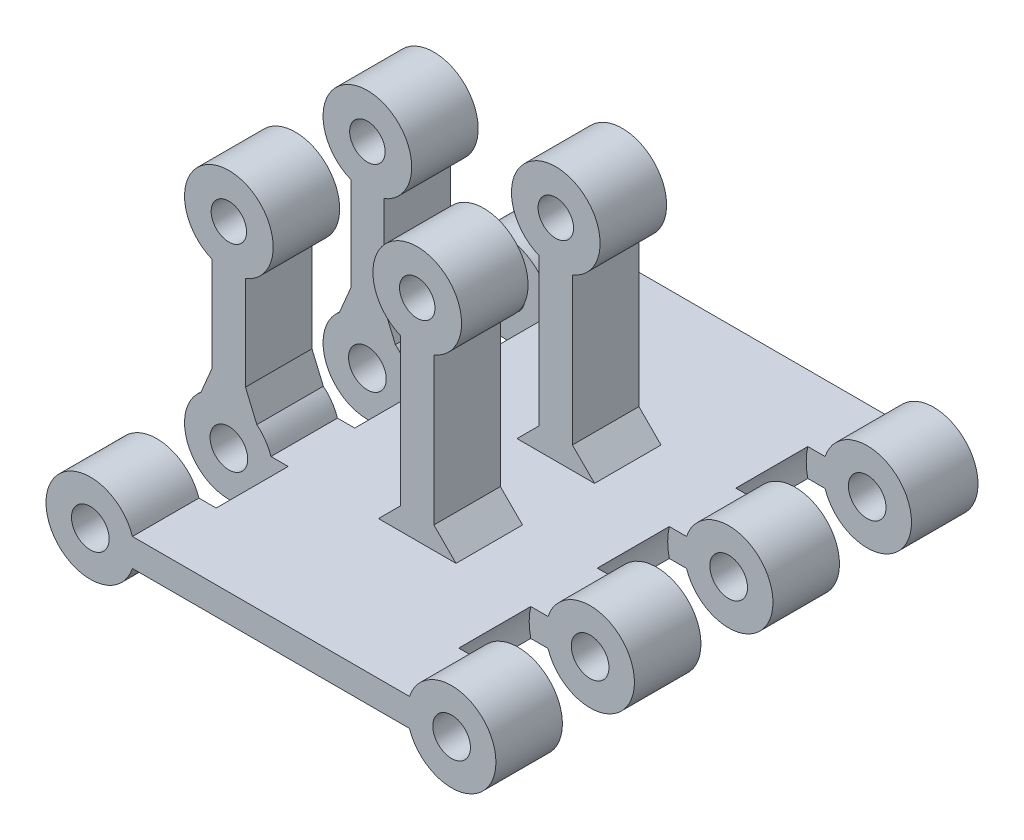
from build123d import *

# Parameters (mm, degrees)
SKETCH_2_R                   = 4
SKETCH_2_R_2                 = 1.7
EXTRUDE_1_DEPTH              = 6
PATTERN_LINEAR_1_COUNT       = 4
PATTERN_LINEAR_1_PITCH       = 12.5
EXTRUDE_START                = -43.5
SKETCH_3_W                   = 25
SKETCH_3_H                   = 2.5
EXTRUDE_2_DEPTH              = 43.5
SKETCH_4_R                   = 5.5
CUT_EXTRUDE_1_DEPTH          = 6.5
PATTERN_LINEAR_2_COUNT       = 4
PATTERN_LINEAR_2_PITCH       = 12.5
PATTERN_START                = 12.5
PATTERN_LINEAR_3_OUTLINE_R   = 1.7
PATTERN_LINEAR_3_DEPTH       = 6
PATTERN_START_2              = 25
PATTERN_LINEAR_3_2_OUTLINE_R = 1.7
PATTERN_LINEAR_3_2_DEPTH     = 6
PATTERN_START_3              = 37.5
PATTERN_LINEAR_3_3_OUTLINE_R = 1.7
PATTERN_LINEAR_3_3_DEPTH     = 6
MIRROR_3_COPY_1_SKETCH_R     = 5.5
MIRROR_3_COPY_1_DEPTH        = 6.5
MIRROR_3_COPY_2_SKETCH_R     = 5.5
MIRROR_3_COPY_2_DEPTH        = 6.5
MIRROR_3_COPY_3_SKETCH_R     = 5.5
MIRROR_3_COPY_3_DEPTH        = 6.5
SKETCH_5_W                   = 3
SKETCH_5_H                   = 14
SKETCH_5_H_2                 = 19
EXTRUDE_3_DEPTH              = 6
SKETCH_6_R                   = 4
EXTRUDE_4_DEPTH              = 6
CUT_EXTRUDE_2_DEPTH          = 20
CUT_EXTRUDE_2_DEPTH_BACK     = 10
SKETCH_7_R                   = 1.6
CHAMFER_1_SIZE               = 2
CHAMFER_2_SIZE               = 1.81151278


with BuildPart() as part:
    # Эскиз2 → Бобышка-Вытянуть1 (new body)
    with BuildSketch(Plane.XY):
        Circle(SKETCH_2_R)
        Circle(SKETCH_2_R_2, mode=Mode.SUBTRACT)
    extrude_1 = extrude(amount=EXTRUDE_1_DEPTH)


with BuildPart() as pattern_linear_1_1:
    # Линейный массив1: pattern copy
    add(part.part.moved(Location(Vector(0, 0, 1) * (1 * PATTERN_LINEAR_1_PITCH))))


with BuildPart() as pattern_linear_1_2:
    # Линейный массив1: pattern copy
    add(part.part.moved(Location(Vector(0, 0, 1) * (2 * PATTERN_LINEAR_1_PITCH))))


with BuildPart() as pattern_linear_1_3:
    # Линейный массив1: pattern copy
    add(part.part.moved(Location(Vector(0, 0, 1) * (3 * PATTERN_LINEAR_1_PITCH))))


with BuildPart() as part_1:
    add(part.part)

    add(pattern_linear_1_1.part)  # Бобышка-Вытянуть2 merges Линейный массив1_1

    add(pattern_linear_1_2.part)  # Бобышка-Вытянуть2 merges Линейный массив1_2

    add(pattern_linear_1_3.part)  # Бобышка-Вытянуть2 merges Линейный массив1_3
    # Эскиз3 → Бобышка-Вытянуть2 (add)
    with BuildSketch(Plane(origin=(0, 0, 0), x_dir=(-1, 0, 0), z_dir=(0, 0, -1)).offset(EXTRUDE_START)):
        with Locations((16.299671038, 0)):
            Rectangle(SKETCH_3_W, SKETCH_3_H)
    extrude(amount=EXTRUDE_2_DEPTH)

    # Эскиз4 → Вырез-Вытянуть1 (cut)
    with BuildSketch(Plane.XY.offset(6)):
        Circle(SKETCH_4_R)
    cut_extrude_1 = extrude(amount=CUT_EXTRUDE_1_DEPTH, mode=Mode.SUBTRACT)

    # Линейный массив2: Вырез-Вытянуть1 ×4
    with Locations(*[(0, 0, i * PATTERN_LINEAR_2_PITCH) for i in range(1, PATTERN_LINEAR_2_COUNT)]):
        add(cut_extrude_1, mode=Mode.SUBTRACT)

    # Зеркальное отражение1: Бобышка-Вытянуть1 across plane
    add(extrude_1.mirror(Plane.ZY.offset(16.299671038)))

    # Линейный массив3: read off the stored shape, not the designer's step
    # Линейный массив3 outline → Линейный массив3 (add)
    with BuildSketch(Plane.XY.offset(PATTERN_START)):
        with BuildLine():
            ThreePointArc((-28.799671038, 1.25), (-36.599342077, 0), (-28.799671038, -1.25))
            Line((-28.799671038, -1.25), (-28.799671038, 1.25))
        make_face()
        with Locations((-32.599342077, 0)):
            Circle(PATTERN_LINEAR_3_OUTLINE_R, mode=Mode.SUBTRACT)
    extrude(amount=PATTERN_LINEAR_3_DEPTH)

    # Pattern Linear 3 2 outline → Pattern Linear 3 2 (add)
    with BuildSketch(Plane.XY.offset(PATTERN_START_2)):
        with BuildLine():
            ThreePointArc((-28.799671038, 1.25), (-36.599342077, 0), (-28.799671038, -1.25))
            Line((-28.799671038, -1.25), (-28.799671038, 1.25))
        make_face()
        with Locations((-32.599342077, 0)):
            Circle(PATTERN_LINEAR_3_2_OUTLINE_R, mode=Mode.SUBTRACT)
    extrude(amount=PATTERN_LINEAR_3_2_DEPTH)

    # Pattern Linear 3 3 outline → Pattern Linear 3 3 (add)
    with BuildSketch(Plane.XY.offset(PATTERN_START_3)):
        with BuildLine():
            ThreePointArc((-28.799671038, 1.25), (-36.599342077, 0), (-28.799671038, -1.25))
            Line((-28.799671038, -1.25), (-28.799671038, 1.25))
        make_face()
        with Locations((-32.599342077, 0)):
            Circle(PATTERN_LINEAR_3_3_OUTLINE_R, mode=Mode.SUBTRACT)
    extrude(amount=PATTERN_LINEAR_3_3_DEPTH)

    # Зеркальное отражение3: Вырез-Вытянуть1 across plane
    add(cut_extrude_1.mirror(Plane.ZY.offset(16.299671038)), mode=Mode.SUBTRACT)

    # Зеркальное отражение3 copy 1 sketch → Зеркальное отражение3 copy 1 (cut)
    with BuildSketch(Plane(origin=(-32.599342077, 0, 18.5), x_dir=(-1, 0, 0), z_dir=(0, 0, 1))):
        Circle(MIRROR_3_COPY_1_SKETCH_R)
    extrude(amount=MIRROR_3_COPY_1_DEPTH, mode=Mode.SUBTRACT)

    # Зеркальное отражение3 copy 2 sketch → Зеркальное отражение3 copy 2 (cut)
    with BuildSketch(Plane(origin=(-32.599342077, 0, 31), x_dir=(-1, 0, 0), z_dir=(0, 0, 1))):
        Circle(MIRROR_3_COPY_2_SKETCH_R)
    extrude(amount=MIRROR_3_COPY_2_DEPTH, mode=Mode.SUBTRACT)

    # Зеркальное отражение3 copy 3 sketch → Зеркальное отражение3 copy 3 (cut)
    with BuildSketch(Plane(origin=(-32.599342077, 0, 43.5), x_dir=(-1, 0, 0), z_dir=(0, 0, 1))):
        Circle(MIRROR_3_COPY_3_SKETCH_R)
    extrude(amount=MIRROR_3_COPY_3_DEPTH, mode=Mode.SUBTRACT)

    # Эскиз5 → Бобышка-Вытянуть3 (add)
    with BuildSketch(Plane(origin=(0, 0, 12.5), x_dir=(-1, 0, 0), z_dir=(0, 0, -1))):
        with Locations((32.599342077, 10.708099244)):
            Rectangle(SKETCH_5_W, SKETCH_5_H)
        with Locations((15.599342077, 10.75)):
            Rectangle(SKETCH_5_W, SKETCH_5_H_2)
    extrude_3 = extrude(amount=-EXTRUDE_3_DEPTH)

    # Зеркальное отражение4: Бобышка-Вытянуть3 across plane
    add(extrude_3.mirror(Plane.XY.offset(21.75)))

    # Эскиз6 → Бобышка-Вытянуть4 (add)
    with BuildSketch(Plane(origin=(0, 0, 25), x_dir=(-1, 0, 0), z_dir=(0, 0, -1))):
        with Locations((32.599342077, 17.708099244)):
            Circle(SKETCH_6_R)
        with Locations((15.599342077, 20.25)):
            Circle(SKETCH_6_R)
    extrude_4 = extrude(amount=-EXTRUDE_4_DEPTH)

    # Зеркальное отражение5: Бобышка-Вытянуть4 across plane
    add(extrude_4.mirror(Plane.XY.offset(21.75)))

    # Эскиз7 → Вырез-Вытянуть2 (cut, two sides: drawn at the far end of the back side and taken through both)
    with BuildSketch(Plane(origin=(0, 0, 25), x_dir=(-1, 0, 0), z_dir=(0, 0, -1)).offset(-CUT_EXTRUDE_2_DEPTH_BACK)):
        with Locations(Location((32.599342077, 17.708099244, 0), (0, 0, 180))):
            Circle(SKETCH_7_R)
        with Locations(Location((15.599342077, 20.25, 0), (0, 0, 180))):
            Circle(SKETCH_7_R)
    extrude(amount=CUT_EXTRUDE_2_DEPTH + CUT_EXTRUDE_2_DEPTH_BACK, mode=Mode.SUBTRACT)

    # Фаска1
    chamfer_1_edges = [part_1.edges().sort_by_distance(p)[0] for p in [
        (-14.099342077, 1.25, 15.5),
        (-17.099342077, 1.25, 15.5),
        (-14.099342077, 1.25, 28),
        (-17.099342077, 1.25, 28),
    ]]
    chamfer(chamfer_1_edges, length=CHAMFER_1_SIZE)

    # Фаска2
    # the kernel refuses this chamfer: 1.81151278, 1 mm, written as the material it adds along each edge
    with BuildSketch(Plane(origin=(-31.099342077, 3.708099244, 12.5), x_dir=(0, 1, 0), z_dir=(0, 0, 1))) as chamfer_2_piece_1:
        with BuildLine():
            Line((CHAMFER_2_SIZE, 0), (-0.60562029, -1.024801843))
            ThreePointArc((-0.60562029, -1.024801843), (-0.279646114, -0.560511864), (0, 0))
            Line((0, 0), (CHAMFER_2_SIZE, 0))
        make_face()
    extrude(amount=6)
    with BuildSketch(Plane(origin=(-34.099342077, 3.708099244, 12.5), x_dir=(-0.8609060833404796, -0.5087639095566383, 0), z_dir=(0, 0, 1))) as chamfer_2_piece_2:
        with BuildLine():
            Line((1.190375888, 0), (-CHAMFER_2_SIZE * 0.508763909682, -CHAMFER_2_SIZE * 0.860906083552))
            Line((-CHAMFER_2_SIZE * 0.508763909682, -CHAMFER_2_SIZE * 0.860906083552), (0, 0))
            ThreePointArc((0, 0), (0.624821924, -0.044419166), (1.190375888, 0))
        make_face()
    extrude(amount=6)
    with BuildSketch(Plane(origin=(-31.099342077, 3.708099244, 31), x_dir=(0, 1, 0), z_dir=(0, 0, -1))) as chamfer_2_piece_3:
        with BuildLine():
            Line((CHAMFER_2_SIZE, 0), (-0.60562029, 1.024801843))
            ThreePointArc((-0.60562029, 1.024801843), (-0.279646114, 0.560511864), (0, 0))
            Line((0, 0), (CHAMFER_2_SIZE, 0))
        make_face()
    extrude(amount=6)
    with BuildSketch(Plane(origin=(-34.099342077, 3.708099244, 31), x_dir=(-0.8609060833404796, -0.5087639095566383, 0), z_dir=(0, 0, -1))) as chamfer_2_piece_4:
        with BuildLine():
            Line((1.190375888, 0), (-CHAMFER_2_SIZE * 0.508763909682, CHAMFER_2_SIZE * 0.860906083552))
            Line((-CHAMFER_2_SIZE * 0.508763909682, CHAMFER_2_SIZE * 0.860906083552), (0, 0))
            ThreePointArc((0, 0), (0.624821924, 0.044419166), (1.190375888, 0))
        make_face()
    extrude(amount=6)


solid = part_1.part
